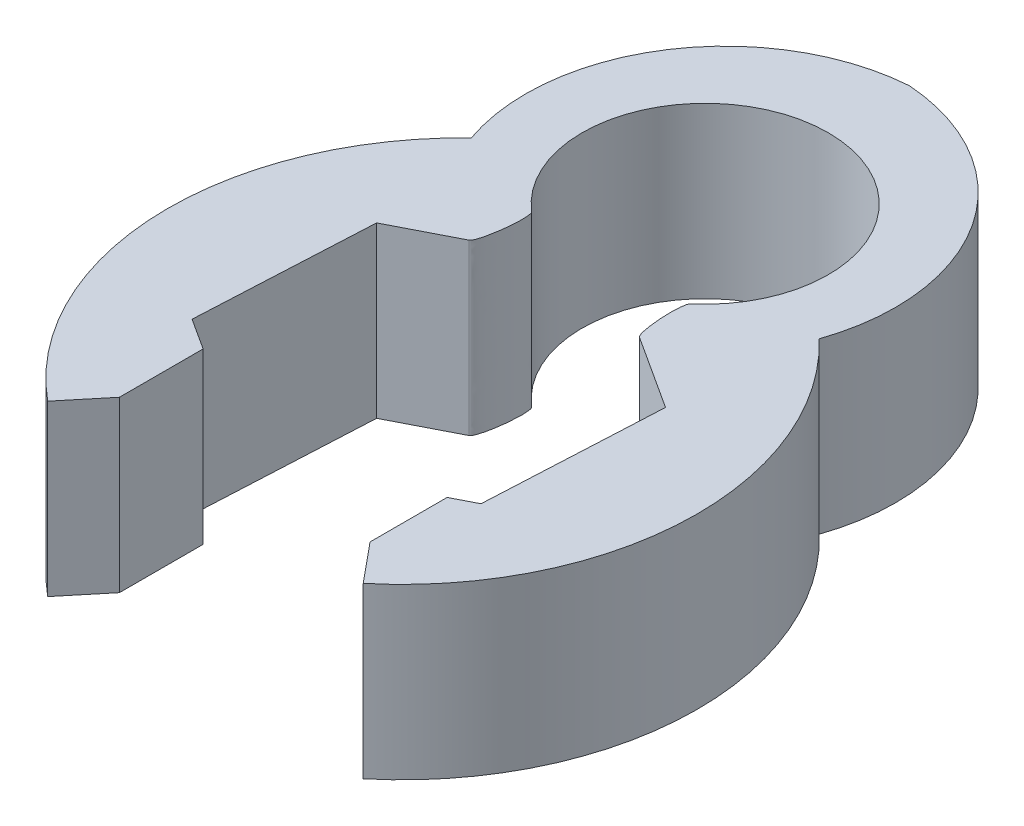
from build123d import *

# Parameters (mm, degrees)
BOSS_EXTRUDE1_DEPTH = 6.35


with BuildPart() as part:
    # Sketch3 → Boss-Extrude1 (new body)
    with BuildSketch(Plane(origin=(0, 0, 0), x_dir=(1, 0, 0), z_dir=(0, 1, 0))):
        with BuildLine():
            Line((-5.541525375, 3.58326618), (-2.47962532, 5.150959008))
            Line((-2.47962532, 5.150959008), (-2.47962532, 6.474170352))
            ThreePointArc((-2.47962532, 6.474170352), (-2.221563685, 14.417025562), (4.617359972, 10.369227654))
            ThreePointArc((4.617359972, 10.369227654), (4.047797908, 8.147663968), (2.47962532, 6.474170352))
            Line((2.47962532, 6.474170352), (2.47962532, 5.20231788))
            Line((2.47962532, 5.20231788), (5.873962228, 3.007468661))
            Line((5.873962228, 3.007468661), (5.541525375, -3.58326618))
            Line((5.541525375, -3.58326618), (4.701204968, -4.013510228))
            Line((4.701204968, -4.013510228), (4.701204968, -6.905610932))
            Line((4.701204968, -6.905610932), (5.918780254, -8.378526195))
            ThreePointArc((5.918780254, -8.378526195), (9.922634137, -0.265088751), (6.526624698, 8.120961152))
            ThreePointArc((6.526624698, 8.120961152), (5.706991897, 14.686716316), (0, 18.035026682))
            ThreePointArc((0, 18.035026682), (-5.706991897, 14.686716316), (-6.526624698, 8.120961152))
            ThreePointArc((-6.526624698, 8.120961152), (-9.922634137, -0.265088751), (-5.918780254, -8.378526195))
            Line((-5.918780254, -8.378526195), (-4.701204968, -6.905610932))
            Line((-4.701204968, -6.905610932), (-4.701204968, -3.765798027))
            Line((-4.701204968, -3.765798027), (-5.873962228, -3.007468661))
            Line((-5.873962228, -3.007468661), (-5.541525375, 3.58326618))
        make_face()
        with BuildLine():
            Line((-2.47962532, 6.474170352), (-2.47962532, 5.150959008))
            Line((-2.47962532, 5.150959008), (-1.063503338, 5.876013463))
            ThreePointArc((-1.063503338, 5.876013463), (-1.79663243, 6.115743784), (-2.47962532, 6.474170352))
        make_face()
        with BuildLine():
            ThreePointArc((2.47962532, 6.474170352), (1.921985685, 6.17089654), (1.328021538, 5.946968965))
            Line((1.328021538, 5.946968965), (2.47962532, 5.20231788))
            Line((2.47962532, 5.20231788), (2.47962532, 6.474170352))
        make_face()
    extrude(amount=BOSS_EXTRUDE1_DEPTH)

    # Fillet6
    # a fillet whose section is not a circle: 1.27 mm, written as the material it takes off along each edge
    with BuildSketch(Plane(origin=(1.328021538, -5.283304691, -5.946968965), x_dir=(0.8397378391322112, 0, 0.5429920455490709), z_dir=(0, 1, 0))) as fillet6_piece_1:
        with BuildLine():
            Bezier((2.113321876, 0), (0.3966534, 0), (0.898889741, 1.641556979), weights=[1, 0.118948346, 1])
            ThreePointArc((0.898889741, 1.641556979), (0.533488386, 0.774757636), (0, 0))
            Line((0, 0), (2.113321876, 0))
        make_face()
    extrude(amount=16.916609382, mode=Mode.SUBTRACT)
    with BuildSketch(Plane(origin=(-1.063503338, -6.120582224, -5.876013463), x_dir=(-0.891835980226881, 0, -0.4523589110128793), z_dir=(0, 1, 0))) as fillet6_piece_2:
        with BuildLine():
            Bezier((2.168149873, 0), (0.323600022, 0.445521101), (1.438773255, 1.980852292), weights=[1, 0.11123936, 1])
            Line((1.438773255, 1.980852292), (0, 0))
            ThreePointArc((0, 0), (1.084074937, 0.129064678), (2.168149873, 0))
        make_face()
    extrude(amount=18.591164449, mode=Mode.SUBTRACT)


solid = part.part
